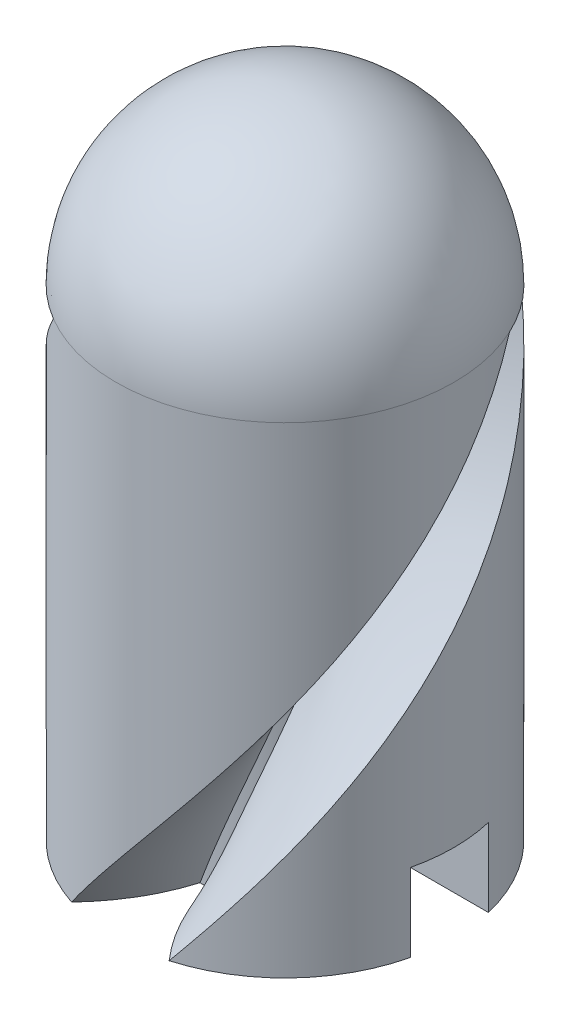
from build123d import *

# Parameters (mm, degrees)
SKETCH3_R           = 6.5
BOSS_EXTRUDE3_DEPTH = 18.5
THREAD4_PITCH       = 50
THREAD6_PITCH       = 50
REVOLVE1_ANGLE      = 180
SKETCH8_W           = 3.810225099
SKETCH8_H           = 3
CUT_EXTRUDE3_DEPTH  = 3


with BuildPart() as part:
    # Sketch3 → Boss-Extrude3 (new body)
    with BuildSketch(Plane(origin=(0, 0, 0), x_dir=(-1, 0, 0), z_dir=(0, 1, 0))):
        with Locations(Location((0, 0, 0), (0, 0, 90))):
            Circle(SKETCH3_R)
    extrude(amount=BOSS_EXTRUDE3_DEPTH)

    # Thread4: the profile of Thread Profile6 profile screwed along a right-hand helix of 0.47 turns, 26 arcs to a turn; built about Z, then put on its axis
    thread4_z = Axis((0, 0, 0), (0, 0, 1))
    thread4_corners = [(6.5003, -2e-09, -0.000173205), (3.062961694, -1e-09, 1.984374991), (3.062961694, -1e-09, 2.778124991), (6.5003, -2e-09, 4.762673188)]
    with BuildLine(mode=Mode.PRIVATE) as thread4_profile:
        Line(thread4_corners[0], thread4_corners[1])
        Line(thread4_corners[1], thread4_corners[2])
        Line(thread4_corners[2], thread4_corners[3])
        Line(thread4_corners[3], thread4_corners[0])
    thread4_cap = Face(thread4_profile.wire())
    thread4_turn_angles = [0, 6.923076923, 13.846153846, 20.769230769, 27.692307692, 34.615384615, 41.538461538, 48.461538462, 55.384615385, 62.307692308, 69.230769231, 76.153846154, 83.076923077, 90, 96.923076923, 103.846153846, 110.769230769, 117.692307692, 124.615384615, 131.538461538, 138.461538462, 145.384615385, 152.307692308, 159.230769231, 166.153846154, 167.676923077, 169.2]
    thread4_turn_weights = [1, 0.992708874098054, 1, 0.992708874098054, 1, 0.992708874098054, 1, 0.992708874098054, 1, 0.992708874098054, 1, 0.992708874098054, 1, 0.992708874098054, 1, 0.992708874098054, 1, 0.992708874098054, 1, 0.992708874098054, 1, 0.992708874098054, 1, 0.992708874098054, 1, 0.9996467006478118, 1]
    thread4_turn_rails = [Edge.make_bspline([Vector(p[0], p[1], 0).rotate(thread4_z, thread4_turn_angles[k]) / thread4_turn_weights[k] + Vector(0, 0, p[2] + THREAD4_PITCH * thread4_turn_angles[k] / 360) for k in range(27)], [0, 0, 0, 1, 1, 2, 2, 3, 3, 4, 4, 5, 5, 6, 6, 7, 7, 8, 8, 9, 9, 10, 10, 11, 11, 12, 12, 13, 13, 13], 2, thread4_turn_weights) for p in thread4_corners]
    thread4_turn_sides = [Face.make_surface_from_curves(thread4_turn_rails[p[0]], thread4_turn_rails[p[1]]) for p in [(0, 1), (1, 2), (2, 3), (3, 0)]]
    thread4 = Plane(origin=(0, -5, 0), x_dir=(-0.342020143, 0, 0.939692621), z_dir=(0, 1, 0)) * Solid(Shell([*thread4_turn_sides, thread4_cap, thread4_cap.rotate(thread4_z, 169.2).moved(Location((0, 0, THREAD4_PITCH * 169.2 / 360)))]))
    add(thread4, mode=Mode.SUBTRACT)

    # Thread6: the profile of Thread Profile8 profile screwed along a right-hand helix of 0.47 turns, 26 arcs to a turn; built about Z, then put on its axis
    thread6_z = Axis((0, 0, 0), (0, 0, 1))
    thread6_corners = [(6.5003, -2e-09, -0.000173205), (3.062961694, -1e-09, 1.984374991), (3.062961694, -1e-09, 2.778124991), (6.5003, -2e-09, 4.762673188)]
    with BuildLine(mode=Mode.PRIVATE) as thread6_profile:
        Line(thread6_corners[0], thread6_corners[1])
        Line(thread6_corners[1], thread6_corners[2])
        Line(thread6_corners[2], thread6_corners[3])
        Line(thread6_corners[3], thread6_corners[0])
    thread6_cap = Face(thread6_profile.wire())
    thread6_turn_angles = [0, 6.923076923, 13.846153846, 20.769230769, 27.692307692, 34.615384615, 41.538461538, 48.461538462, 55.384615385, 62.307692308, 69.230769231, 76.153846154, 83.076923077, 90, 96.923076923, 103.846153846, 110.769230769, 117.692307692, 124.615384615, 131.538461538, 138.461538462, 145.384615385, 152.307692308, 159.230769231, 166.153846154, 167.676923077, 169.2]
    thread6_turn_weights = [1, 0.992708874098054, 1, 0.992708874098054, 1, 0.992708874098054, 1, 0.992708874098054, 1, 0.992708874098054, 1, 0.992708874098054, 1, 0.992708874098054, 1, 0.992708874098054, 1, 0.992708874098054, 1, 0.992708874098054, 1, 0.992708874098054, 1, 0.992708874098054, 1, 0.9996467006478116, 1]
    thread6_turn_rails = [Edge.make_bspline([Vector(p[0], p[1], 0).rotate(thread6_z, thread6_turn_angles[k]) / thread6_turn_weights[k] + Vector(0, 0, p[2] + THREAD6_PITCH * thread6_turn_angles[k] / 360) for k in range(27)], [0, 0, 0, 1, 1, 2, 2, 3, 3, 4, 4, 5, 5, 6, 6, 7, 7, 8, 8, 9, 9, 10, 10, 11, 11, 12, 12, 13, 13, 13], 2, thread6_turn_weights) for p in thread6_corners]
    thread6_turn_sides = [Face.make_surface_from_curves(thread6_turn_rails[p[0]], thread6_turn_rails[p[1]]) for p in [(0, 1), (1, 2), (2, 3), (3, 0)]]
    thread6 = Plane(origin=(0, -5, 0), x_dir=(0.342020143, 0, -0.939692621), z_dir=(0, 1, 0)) * Solid(Shell([*thread6_turn_sides, thread6_cap, thread6_cap.rotate(thread6_z, 169.2).moved(Location((0, 0, THREAD6_PITCH * 169.2 / 360)))]))
    add(thread6, mode=Mode.SUBTRACT)

    # Sketch7 → Revolve1 (revolve)
    with BuildSketch(Plane(origin=(0, 18.5, 0), x_dir=(1, 0, 0), z_dir=(0, 1, 0))):
        with BuildLine():
            Line((-6.5, 0), (6.5, 0))
            ThreePointArc((6.5, 0), (0, 6.5), (-6.5, 0))
        make_face()
    revolve(axis=Axis((-6.5, 18.5, 0), (1, 0, 0)), revolution_arc=REVOLVE1_ANGLE)

    # Sketch8 → Cut-Extrude3 (cut)
    with BuildSketch(Plane.XZ):
        with Locations((-4.90511255, 0)):
            Rectangle(SKETCH8_W, SKETCH8_H)
        with Locations((4.90511255, 0)):
            Rectangle(SKETCH8_W, SKETCH8_H)
    extrude(amount=-CUT_EXTRUDE3_DEPTH, mode=Mode.SUBTRACT)


solid = part.part
